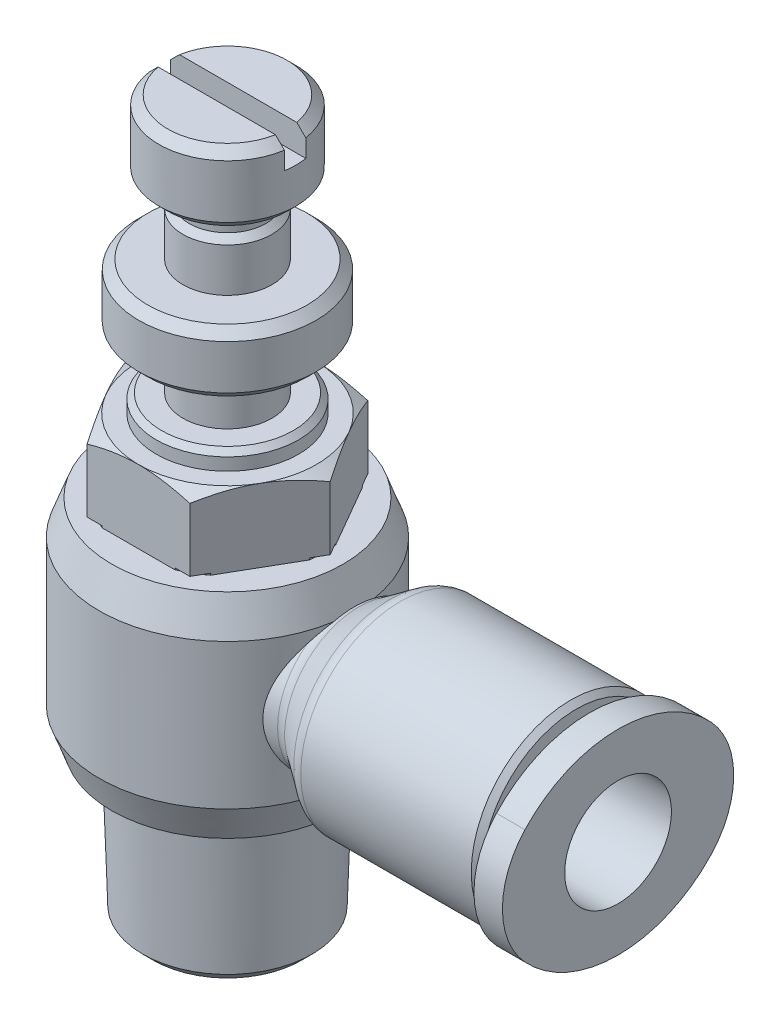
from build123d import *
from build123d.topology import SkipClean

# Parameters (mm, degrees)
SKETCH4_R               = 7
CUT_EXTRUDE1_DEPTH      = 4.1
CUT_EXTRUDE2_DEPTH      = 4.3
CUT_EXTRUDE2_DEPTH_BACK = 4.3
SKETCH6_W               = 1.2
SKETCH6_H               = 1.5
SKETCH9_W               = 25.192666667
SKETCH9_H               = 3
SKETCH10_W              = 3.242666667
SKETCH10_H              = 14.65
SKETCH11_W              = 0.75
SKETCH11_H              = 3.75
BOSS_EXTRUDE2_DEPTH     = 1.6
SKETCH13_W              = 2.35
SKETCH13_H              = 3


with BuildPart() as part:
    # Sketch1 → Revolve1 (revolve)
    with BuildSketch(Plane.XY):
        with BuildLine():
            Line((19.6, 0), (19.6, -5.3))
            Line((19.6, -5.3), (19.3, -5.6))
            Line((19.3, -5.6), (9.717578433, -5.6))
            ThreePointArc((9.717578433, -5.6), (9.414897034, -5.553091796), (9.140612117, -5.416767941))
            Line((9.140612117, -5.416767941), (7.394387883, -4.183232059))
            ThreePointArc((7.394387883, -4.183232059), (7.120102966, -4.046908204), (6.817421567, -4))
            Line((6.817421567, -4), (0, -4))
            Line((0, -4), (0, 0))
            Line((0, 0), (19.6, 0))
        make_face()
    revolve(axis=Axis((0, 0, 0), (1, 0, 0)))

    # Sketch2 → Revolve2 (revolve)
    with BuildSketch(Plane.XY):
        Polygon((0, -6.2), (-6.5, -6.2), (-7.2, -4.277), (-7.2, 3.877), (-6.5, 5.8), (0, 5.8), align=None)
    revolve(axis=Axis((0, 5.8, 0), (0, -1, 0)))

    # Sketch3 → Revolve3 (revolve)
    with BuildSketch(Plane.XY):
        Polygon((0, 5.8), (-5.4, 5.8), (-5.4, 5.9), (-5.774, 5.9), (-5.774, 9.9), (-4, 9.9), (-4, 10.6), (-3.7, 10.9), (-2.5, 10.9), (-2.5, 13.9), (-4.477, 13.9), (-4.977, 14.4), (-4.977, 16.9), (-4.477, 17.4), (-2.5, 17.4), (-2.5, 19.85), (-2.15, 20.2), (-2.15, 21.4), (-3.35, 21.4), (-3.85, 21.9), (-3.85, 24.9), (-3.35, 25.4), (0, 25.4), align=None)
    revolve(axis=Axis((0, 25.4, 0), (0, -1, 0)))

    # Sketch4 → Cut-Extrude1 (cut)
    with BuildSketch(Plane(origin=(0, 9.9, 0), x_dir=(-1, 0, 0), z_dir=(0, 1, 0))):
        Circle(SKETCH4_R)
        Polygon((5.773502692, 0), (2.886751346, 5), (-2.886751346, 5), (-5.773502692, 0), (-2.886751346, -5), (2.886751346, -5), align=None, mode=Mode.SUBTRACT)
    extrude(amount=-CUT_EXTRUDE1_DEPTH, mode=Mode.SUBTRACT)

    # Sketch5 → Cut-Revolve1 (revolve, cut)
    with BuildSketch(Plane.XY):
        Polygon((-7, 8.745299462), (-5, 9.9), (-7, 9.9), align=None)
    revolve(axis=Axis((0, 50, 0), (0, -1, 0)), mode=Mode.SUBTRACT)

    # Sketch6 → Cut-Extrude2 (cut, two sides: drawn at the far end of the back side and taken through both)
    with BuildSketch(Plane(origin=(0, 0, 0), x_dir=(0, 0, -1), z_dir=(1, 0, 0)).offset(-CUT_EXTRUDE2_DEPTH_BACK)):
        with Locations((0, 24.65)):
            Rectangle(SKETCH6_W, SKETCH6_H)
    extrude(amount=CUT_EXTRUDE2_DEPTH + CUT_EXTRUDE2_DEPTH_BACK, mode=Mode.SUBTRACT)

    # Sketch7 → Revolve4 (revolve)
    with BuildSketch(Plane.XY):
        Polygon((0, -6.2), (5, -6.2), (5, -6.3), (5.15, -6.3), (5.15, -6.35), (5, -7), (0, -7), align=None)
    revolve(axis=Axis((0, -7, 0), (0, 1, 0)))

    # Sketch8 → Revolve5 (revolve)
    with BuildSketch(Plane.XY):
        Polygon((0, -6.3), (4.999805007, -6.3), (4.757844912, -14.05027692), (4.158121832, -14.65), (0, -14.65), align=None)
    revolve(axis=Axis((0, -14.65, 0), (0, 1, 0)))

    # Sketch9 → Cut-Revolve2 (revolve, cut)
    with BuildSketch(Plane.XY):
        with Locations((9.353666667, 1.5)):
            Rectangle(SKETCH9_W, SKETCH9_H)
    revolve(axis=Axis((21.95, 0, 0), (-1, 0, 0)), mode=Mode.SUBTRACT)

    # Sketch10 → Cut-Revolve3 (revolve, cut)
    with BuildSketch(Plane.XY):
        with Locations((-1.621333334, -7.325)):
            Rectangle(SKETCH10_W, SKETCH10_H)
    revolve(axis=Axis((0, 0, 0), (0, -1, 0)), mode=Mode.SUBTRACT)

    # Sketch11 → Revolve6 (revolve)
    with BuildSketch(Plane.XY):
        with Locations((19.975, 1.875)):
            Rectangle(SKETCH11_W, SKETCH11_H)
    revolve(axis=Axis((20.35, 0, 0), (-1, 0, 0)))

    # Sketch12 → Boss-Extrude2 (add)
    with BuildSketch(Plane(origin=(21.95, 0, 0), x_dir=(0, 0, -1), z_dir=(1, 0, 0))):
        with BuildLine():
            ThreePointArc((-5.232610152, 3.221371493), (-6.4995, 0), (-5.232610152, -3.221371493))
            ThreePointArc((-5.232610152, -3.221371493), (0, -5.499991146), (5.232610152, -3.221371493))
            ThreePointArc((5.232610152, -3.221371493), (6.4995, 0), (5.232610152, 3.221371493))
            ThreePointArc((5.232610152, 3.221371493), (0, 5.499991146), (-5.232610152, 3.221371493))
        make_face()
    extrude(amount=-BOSS_EXTRUDE2_DEPTH)

    # Sketch13 → Cut-Revolve4 (revolve, cut)
    with SkipClean():  # the faces are left unmerged after this step: merging them gives an invalid solid
        with BuildSketch(Plane.XY):
            with Locations((20.775, -1.5)):
                Rectangle(SKETCH13_W, SKETCH13_H)
        revolve(axis=Axis((19.6, 0, 0), (1, 0, 0)), mode=Mode.SUBTRACT)
    add(part.part.scale(1), mode=Mode.REPLACE)  # the faces are merged on a copy


solid = part.part
